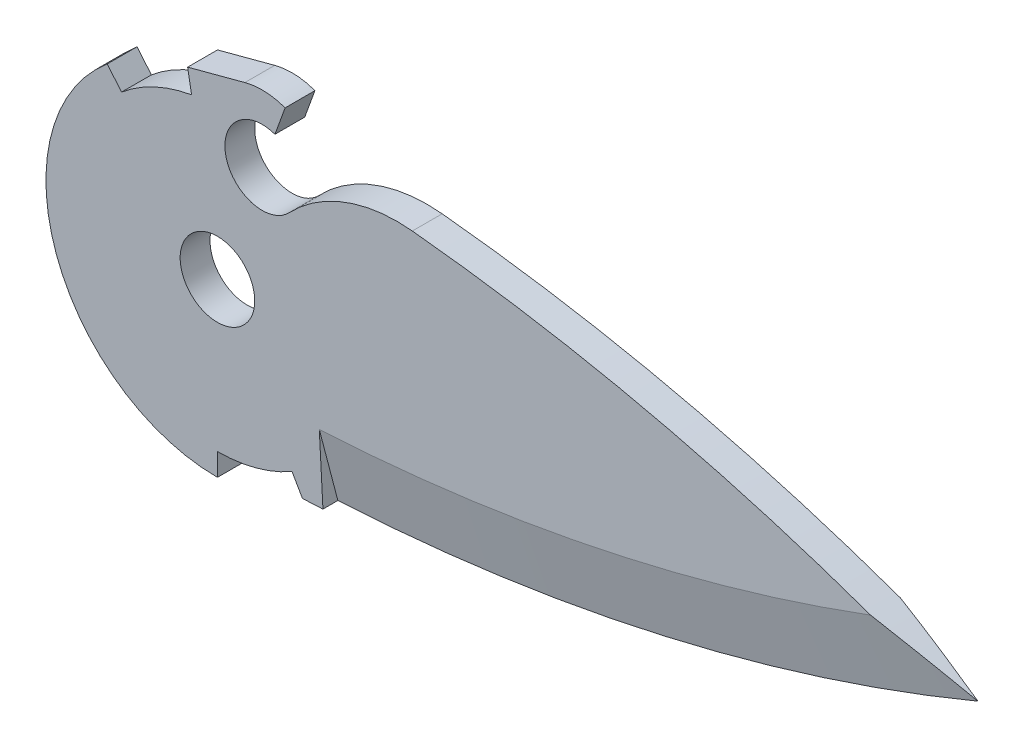
from build123d import *

# Parameters (mm, degrees)
SKICA1_R                = 2.5
P_IDAT_VYSUNUT_M1_DEPTH = 1
ODEBRAT_ROTAC_2_ANGLE   = 19.5


with BuildPart() as part:
    # Skica1 → Přidat vysunutím1 (new, symmetric)
    with BuildSketch(Plane.XY):
        with BuildLine():
            Line((1.841108147, 12.348214538), (-1.996954043, 11.32528916))
            Line((-1.996954043, 11.32528916), (-1.736481777, 9.84807753))
            ThreePointArc((-1.736481777, 9.84807753), (-4.226182617, 9.06307787), (-6.427876097, 7.660444431))
            Line((-6.427876097, 7.660444431), (-7.392057511, 8.809511096))
            ThreePointArc((-7.392057511, 8.809511096), (-10.806465139, -3.933231648), (0, -11.5))
            Line((0, -11.5), (0, -10))
            ThreePointArc((0, -10), (2.588190451, -9.659258263), (5, -8.660254038))
            Line((5, -8.660254038), (5.701288746, -9.874921777))
            ThreePointArc((5.701288746, -9.874921777), (28.284923759, -6.885629951), (50, 0))
            ThreePointArc((50, 0), (31.878604545, 6.030768355), (13.069168565, 9.34139644))
            ThreePointArc((13.069168565, 9.34139644), (8.585652805, 8.76767337), (4.812769581, 6.27841165))
            ThreePointArc((4.812769581, 6.27841165), (0.566440986, 7.427470066), (3.855050358, 10.349231552))
            Line((3.855050358, 10.349231552), (4.539090645, 12.228616794))
            ThreePointArc((4.539090645, 12.228616794), (3.199282928, 12.495585203), (1.841108147, 12.348214538))
        make_face()
        Circle(SKICA1_R, mode=Mode.SUBTRACT)
    extrude(amount=P_IDAT_VYSUNUT_M1_DEPTH, both=True)

    # Skica6 → Odebrat rotací2 (revolve, cut)
    with BuildSketch(Plane(origin=(50, 0, 1), x_dir=(0, 0, -1), z_dir=(0.9230769230769235, 0.38461538461538397, 0))):
        Polygon((1, 0), (2, 4.510708504), (2, 0), align=None)
    odebrat_rotac_2 = revolve(axis=Axis((0, 120, 1), (0, 0, -1)), revolution_arc=ODEBRAT_ROTAC_2_ANGLE, mode=Mode.SUBTRACT)

    # Zrcadlit1: Odebrat rotací2 across plane
    add(odebrat_rotac_2.mirror(Plane.XY), mode=Mode.SUBTRACT)


solid = part.part
